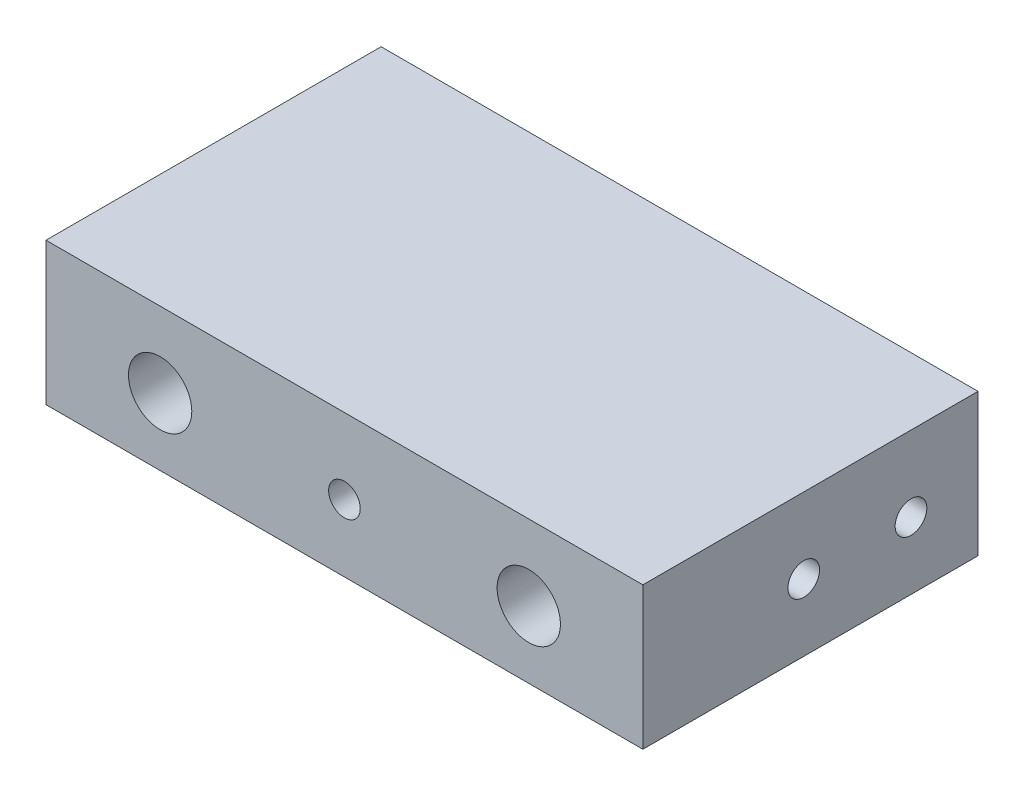
from build123d import *

# Parameters (mm, degrees)
SKETCH1_W           = 56.55
SKETCH1_H           = 12.7
BOSS_EXTRUDE1_DEPTH = 31.75
SKETCH2_R           = 3
SKETCH2_R_2         = 1.5
CUT_EXTRUDE1_DEPTH  = 10
SKETCH3_R           = 1.5
CUT_EXTRUDE2_DEPTH  = 10
SKETCH4_W           = 56.55
SKETCH4_H           = 31.75
BOSS_EXTRUDE2_DEPTH = 0.79375


with BuildPart() as part:
    # Sketch1 → Boss-Extrude1 (new body)
    with BuildSketch(Plane.XY):
        Rectangle(SKETCH1_W, SKETCH1_H)
    extrude(amount=BOSS_EXTRUDE1_DEPTH)

    # Sketch2 → Cut-Extrude1 (cut)
    with BuildSketch(Plane.XY.offset(31.75)):
        with Locations((17.4625, 0)):
            Circle(SKETCH2_R)
        with Locations((-17.4625, 0)):
            Circle(SKETCH2_R)
        Circle(SKETCH2_R_2)
    extrude(amount=-CUT_EXTRUDE1_DEPTH, mode=Mode.SUBTRACT)

    # Sketch3 → Cut-Extrude2 (cut)
    with BuildSketch(Plane.ZY.offset(28.275)):
        with Locations((16.51, 0)):
            Circle(SKETCH3_R)
        with Locations((6.35, 0)):
            Circle(SKETCH3_R)
    cut_extrude2 = extrude(amount=-CUT_EXTRUDE2_DEPTH, mode=Mode.SUBTRACT)

    # Sketch4 → Boss-Extrude2 (add)
    with BuildSketch(Plane(origin=(0, 6.35, 0), x_dir=(1, 0, 0), z_dir=(0, 1, 0))):
        with Locations((0, -15.875)):
            Rectangle(SKETCH4_W, SKETCH4_H)
    extrude(amount=BOSS_EXTRUDE2_DEPTH)

    # Mirror1: Cut-Extrude2 across plane
    add(cut_extrude2.mirror(Plane(origin=(0, 0, 0), x_dir=(0, 0, 1), z_dir=(1, 0, 0))), mode=Mode.SUBTRACT)


solid = part.part
